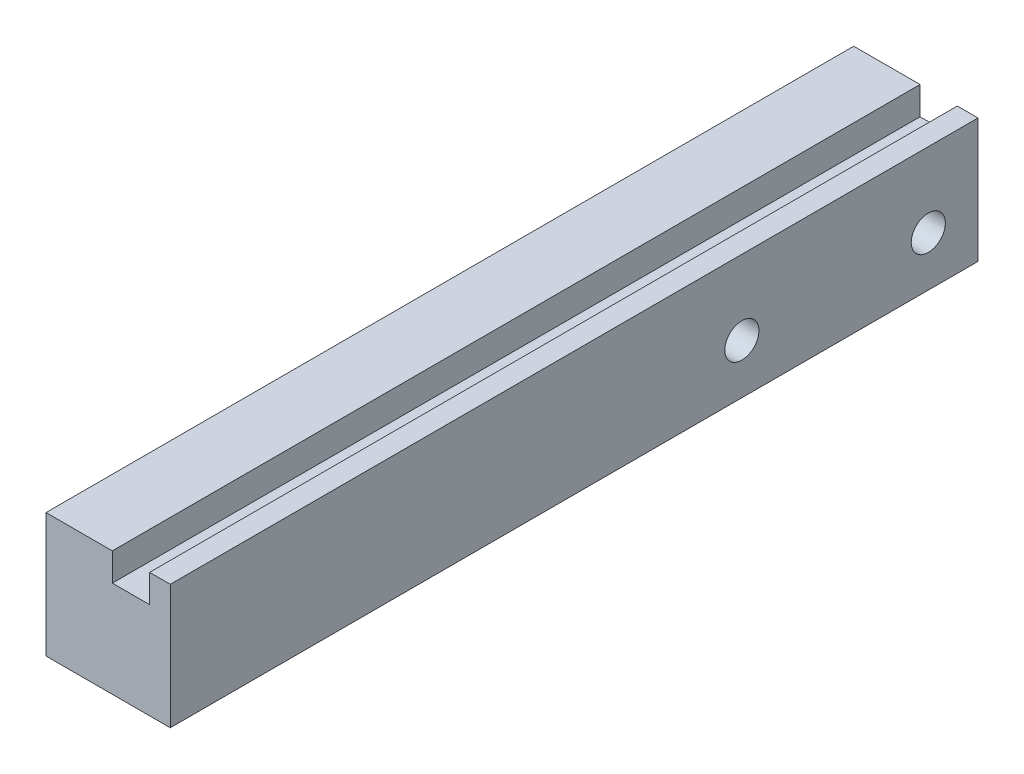
from build123d import *

# Parameters (mm, degrees)
SKETCH_1_W                   = 20
SKETCH_1_H                   = 20
EXTRUDE_1_DEPTH              = 130
SKETCH_2_W                   = 5.996199515
SKETCH_2_H                   = 130
CUT_EXTRUDE_1_DEPTH          = 4.5
HOLE_WIZARD_M5_1_D           = 5.5
HOLE_WIZARD_M5_1_CBORE_D     = 10
HOLE_WIZARD_M5_1_CBORE_DEPTH = 5.4


with BuildPart() as part:
    # 草图1 → 凸台-拉伸1 (new body)
    with BuildSketch(Plane.XY):
        with Locations((10, 10)):
            Rectangle(SKETCH_1_W, SKETCH_1_H)
    extrude(amount=EXTRUDE_1_DEPTH)

    # 草图2 → 切除-拉伸1 (cut)
    with BuildSketch(Plane(origin=(0, 20, 0), x_dir=(1, 0, 0), z_dir=(0, 1, 0))):
        with Locations((13.673460813, -65)):
            Rectangle(SKETCH_2_W, SKETCH_2_H)
    extrude(amount=-CUT_EXTRUDE_1_DEPTH, mode=Mode.SUBTRACT)

    # M5 六角凹头螺钉的柱形沉头孔1 (through all)
    with Locations(Plane.ZY):
        with Locations((8, 8), (38, 8)):
            CounterBoreHole(HOLE_WIZARD_M5_1_D / 2, HOLE_WIZARD_M5_1_CBORE_D / 2, HOLE_WIZARD_M5_1_CBORE_DEPTH)


solid = part.part
